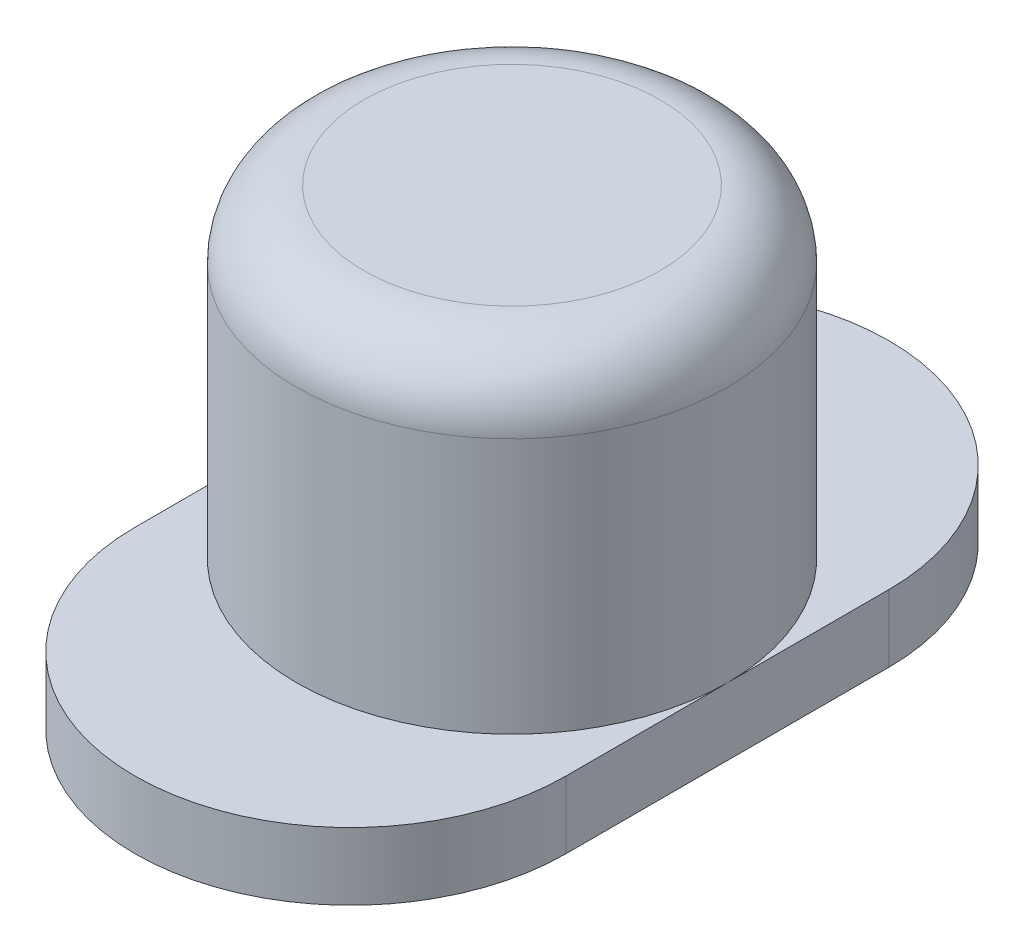
from build123d import *

# Parameters (mm, degrees)
SKETCH2_W          = 3.5
SKETCH2_H          = 2.5
CUT_EXTRUDE1_DEPTH = 3.5
FILLET1_R          = 1.25
CUT_EXTRUDE2_DEPTH = 13.270391192


with BuildPart() as part:
    # Sketch1 → Revolve1 (revolve)
    with BuildSketch(Plane.XY):
        Polygon((0, 7.25), (4, 7.25), (4, 1.25), (7, 1.25), (7, 0), (0, 0), align=None)
    revolve(axis=Axis((0, 7.25, 0), (0, -1, 0)))

    # Sketch2 → Cut-Extrude1 (cut)
    with BuildSketch(Plane.XZ):
        Rectangle(SKETCH2_W, SKETCH2_H)
    extrude(amount=-CUT_EXTRUDE1_DEPTH, mode=Mode.SUBTRACT)

    # Fillet1
    fillet1_edges = [part.edges().sort_by_distance(p)[0] for p in [
        (-4, 7.25, 0),
    ]]
    fillet(fillet1_edges, radius=FILLET1_R)

    # Sketch3 → Cut-Extrude2 (cut, through all)
    with BuildSketch(Plane(origin=(0, 0, 0), x_dir=(1, 0, 0), z_dir=(0, 1, 0))):
        with BuildLine():
            Line((-14, -3), (-14, 3))
            ThreePointArc((-14, 3), (0, 17), (14, 3))
            Line((14, 3), (14, -3))
            ThreePointArc((14, -3), (0, -17), (-14, -3))
        make_face()
        with BuildLine():
            Line((-4, -3), (-4, 3))
            ThreePointArc((-4, 3), (0, 7), (4, 3))
            Line((4, 3), (4, -3))
            ThreePointArc((4, -3), (0, -7), (-4, -3))
        make_face(mode=Mode.SUBTRACT)
    extrude(amount=CUT_EXTRUDE2_DEPTH, mode=Mode.SUBTRACT)


solid = part.part
